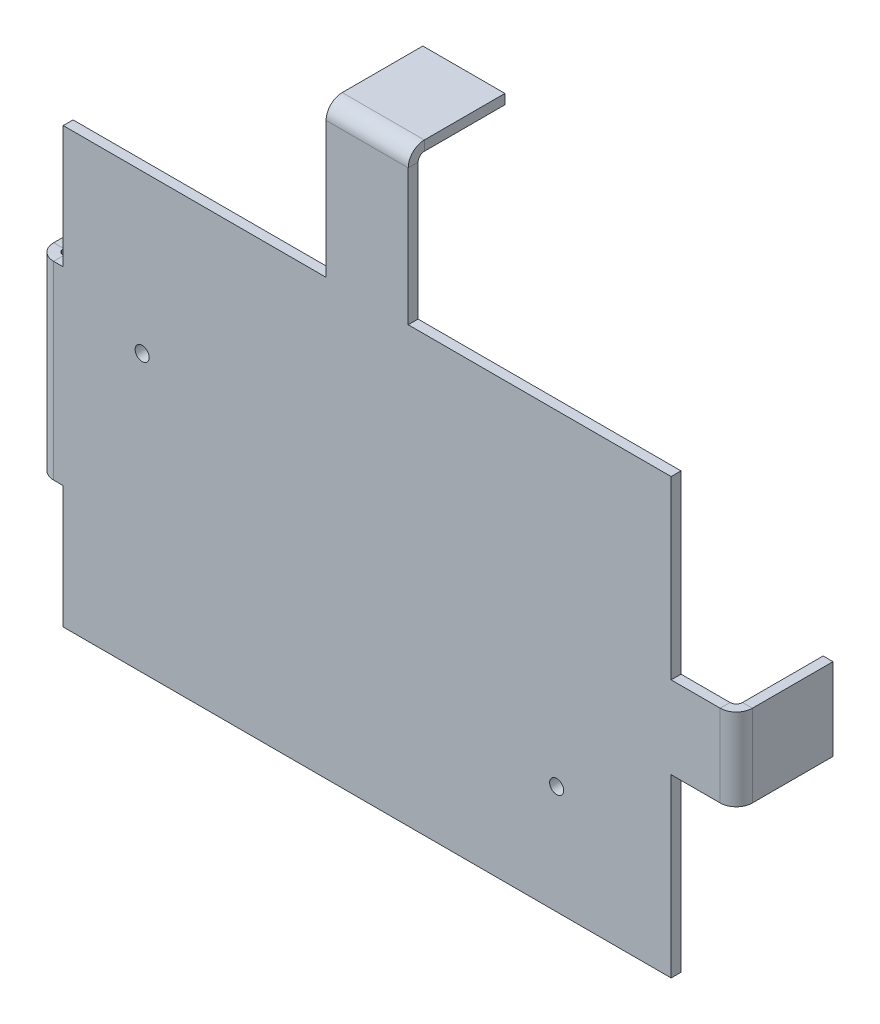
from build123d import *

# Parameters (mm, degrees)
BASE_FLANGE1_DEPTH             = 1.5875
EDGE_FLANGE1_STRIP_W           = 8.35
EDGE_FLANGE1_STRIP_H           = 1.5875
EDGE_FLANGE1_STRIP_CUT_DEPTH   = 30.48
EDGE_FLANGE1_STRIP_2_W         = 8.35
EDGE_FLANGE1_STRIP_2_H         = 1.5875
EDGE_FLANGE1_STRIP_CUT_2_DEPTH = 13.208
EDGE_FLANGE1_STRIP_3_W         = 8.35
EDGE_FLANGE1_STRIP_3_H         = 1.5875
EDGE_FLANGE1_STRIP_CUT_3_DEPTH = 13.208
EDGE_FLANGE1_DEPTH             = 30.48
EDGE_FLANGE1_BEND_DEPTH        = 13.208
EDGE_FLANGE1_BEND_2_DEPTH      = 13.208
F_4_40_TAPPED_HOLE2_D          = 2.2606
F_4_40_TAPPED_HOLE2_DEPTH      = 7.62
F_4_40_TAPPED_HOLE2_TIP        = 0.679152758


# Sheet-metal steps are written as plain solids
with BuildPart() as part:
    # Sketch4 → Base-Flange1 (new body)
    with BuildSketch(Plane.XY.offset(-2116.63312276)):
        Polygon((69.238438529, 17.87770801), (69.238438529, 4.66970801), (60.348438529, 4.66970801), (60.348438529, -23.65129199), (-37.441561471, -23.65129199), (-37.441561471, -3.96629199), (-39.981561471, -3.96629199), (-39.981561471, 26.51370801), (-37.441561471, 26.51370801), (-37.441561471, 46.19870801), (4.849438529, 46.19870801), (4.849438529, 69.05870801), (18.057438529, 69.05870801), (18.057438529, 46.19870801), (60.348438529, 46.19870801), (60.348438529, 17.87770801), align=None)
    extrude(amount=BASE_FLANGE1_DEPTH)

    # Edge-Flange1 strip (across the edge) → Edge-Flange1 strip cut (cut)
    with BuildSketch(Plane(origin=(-39.981561471, -3.96629199, -2116.63312276), x_dir=(1, 0, 0), z_dir=(0, 1, 0))):
        with Locations((-3.175, -0.79375)):
            Rectangle(EDGE_FLANGE1_STRIP_W, EDGE_FLANGE1_STRIP_H)
    extrude(amount=EDGE_FLANGE1_STRIP_CUT_DEPTH, mode=Mode.SUBTRACT)

    # Edge-Flange1 strip 2 (across the edge) → Edge-Flange1 strip cut 2 (cut)
    with BuildSketch(Plane(origin=(4.849438529, 69.05870801, -2116.63312276), x_dir=(0, -1, 0), z_dir=(1, 0, 0))):
        with Locations((-3.175, -0.79375)):
            Rectangle(EDGE_FLANGE1_STRIP_2_W, EDGE_FLANGE1_STRIP_2_H)
    extrude(amount=EDGE_FLANGE1_STRIP_CUT_2_DEPTH, mode=Mode.SUBTRACT)

    # Edge-Flange1 strip 3 (across the edge) → Edge-Flange1 strip cut 3 (cut)
    with BuildSketch(Plane(origin=(69.238438529, 17.87770801, -2116.63312276), x_dir=(-1, 0, 0), z_dir=(0, -1, 0))):
        with Locations((-3.175, -0.79375)):
            Rectangle(EDGE_FLANGE1_STRIP_3_W, EDGE_FLANGE1_STRIP_3_H)
    extrude(amount=EDGE_FLANGE1_STRIP_CUT_3_DEPTH, mode=Mode.SUBTRACT)

    # Edge-Flange1 section (across the edge) → Edge-Flange1 (add)
    with BuildSketch(Plane(origin=(-39.981561471, -3.96629199, -2116.63312276), x_dir=(1, 0, 0), z_dir=(0, 1, 0))):
        with BuildLine():
            Line((-1.5875, 1), (-1.5875, 13.97))
            Line((-1.5875, 13.97), (0, 13.97))
            Line((0, 13.97), (0, 1))
            ThreePointArc((0, 1), (0.292893219, 0.292893219), (1, 0))
            Line((1, 0), (1, -1.5875))
            ThreePointArc((1, -1.5875), (-0.829638796, -0.829638796), (-1.5875, 1))
        make_face()
    extrude(amount=EDGE_FLANGE1_DEPTH)

    # Edge-Flange1 section 2 (across the edge) → Edge-Flange1 bend (add)
    with BuildSketch(Plane(origin=(4.849438529, 69.05870801, -2116.63312276), x_dir=(0, -1, 0), z_dir=(1, 0, 0))):
        with BuildLine():
            Line((-1.5875, 1), (-1.5875, 13.97))
            Line((-1.5875, 13.97), (0, 13.97))
            Line((0, 13.97), (0, 1))
            ThreePointArc((0, 1), (0.292893219, 0.292893219), (1, 0))
            Line((1, 0), (1, -1.5875))
            ThreePointArc((1, -1.5875), (-0.829638796, -0.829638796), (-1.5875, 1))
        make_face()
    extrude(amount=EDGE_FLANGE1_BEND_DEPTH)

    # Edge-Flange1 section 3 (across the edge) → Edge-Flange1 bend 2 (add)
    with BuildSketch(Plane(origin=(69.238438529, 17.87770801, -2116.63312276), x_dir=(-1, 0, 0), z_dir=(0, -1, 0))):
        with BuildLine():
            Line((-1.5875, 1), (-1.5875, 13.97))
            Line((-1.5875, 13.97), (0, 13.97))
            Line((0, 13.97), (0, 1))
            ThreePointArc((0, 1), (0.292893219, 0.292893219), (1, 0))
            Line((1, 0), (1, -1.5875))
            ThreePointArc((1, -1.5875), (-0.829638796, -0.829638796), (-1.5875, 1))
        make_face()
    extrude(amount=EDGE_FLANGE1_BEND_2_DEPTH)

    # #4-40 Tapped Hole2
    with Locations(Plane(origin=(41.933438529, -6.18879199, -2115.04562276), x_dir=(1, 0, 0), z_dir=(0, 0, 1))):
        with Locations((0, 0), (-66.675, 26.9875)):
            Hole(F_4_40_TAPPED_HOLE2_D / 2, depth=F_4_40_TAPPED_HOLE2_DEPTH)
            with Locations((0, 0, -(F_4_40_TAPPED_HOLE2_DEPTH + F_4_40_TAPPED_HOLE2_TIP / 2))):  # 118° drill point
                Cone(0, F_4_40_TAPPED_HOLE2_D / 2, F_4_40_TAPPED_HOLE2_TIP, mode=Mode.SUBTRACT)


solid = part.part
